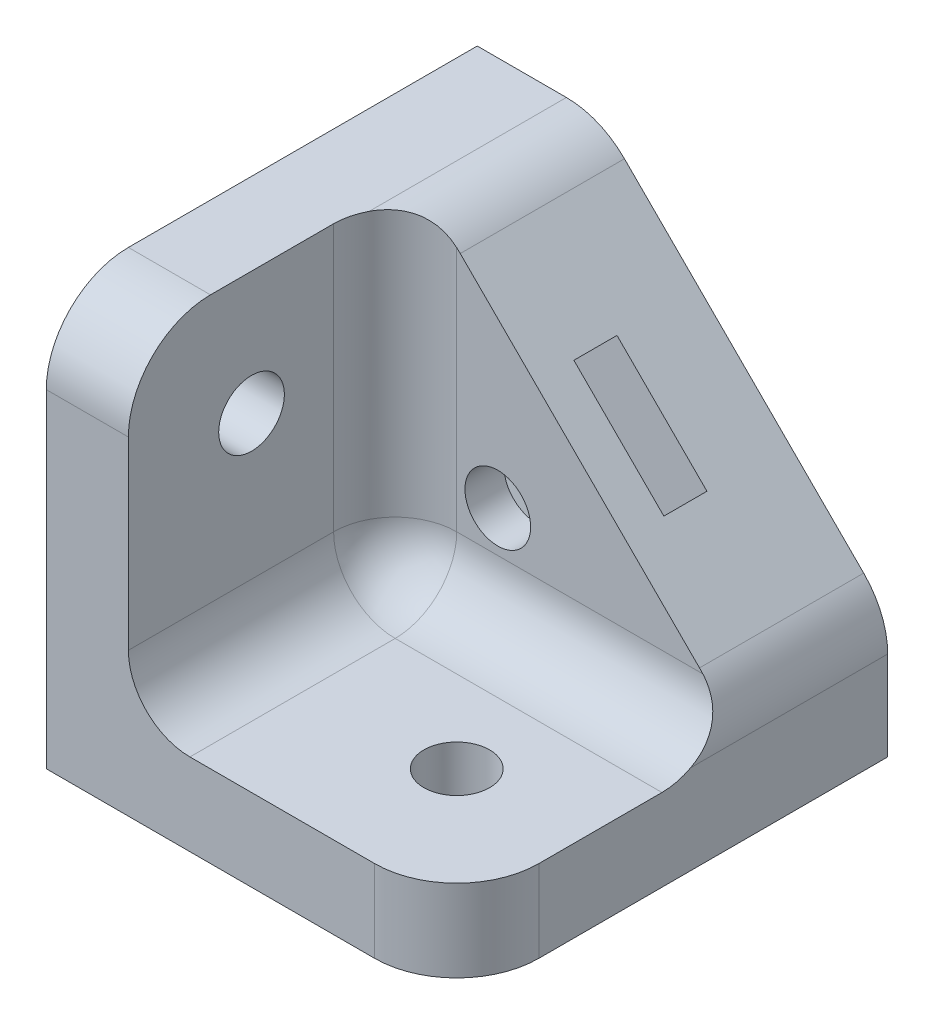
from build123d import *

# Parameters (mm, degrees)
BOSS_EXTRUDE4_DEPTH                  = 8
BOSS_EXTRUDE5_DEPTH                  = 21
SKETCH5_W                            = 2.1
SKETCH5_H                            = 6.2
CUT_EXTRUDE1_DEPTH                   = 9
F_3_2_3_2_DIAMETER_HOLE1_D           = 3.2
F_3_2_3_2_DIAMETER_HOLE1_ON_FACE_2_D = 3.2
F_3_2_3_2_DIAMETER_HOLE1_ON_FACE_3_D = 3.2
CHAMFER1_SIZE                        = 1.5
FILLET1_R                            = 3
FILLET2_R                            = 4


with BuildPart() as part:
    # Sketch4 → Boss-Extrude4 (new body)
    with BuildSketch(Plane.XY):
        Polygon((0, 20), (0, 0), (20, 0), (20, 6), (6, 20), align=None)
    extrude(amount=BOSS_EXTRUDE4_DEPTH)

    # Sketch4<4> → Boss-Extrude5 (add)
    with BuildSketch(Plane.XY):
        Polygon((0, 20), (0, 0), (20, 0), (20, 4), (4, 4), (4, 20), align=None)
    extrude(amount=BOSS_EXTRUDE5_DEPTH)

    # Sketch5 → Cut-Extrude1 (cut)
    with BuildSketch(Plane(origin=(13, 13, 0), x_dir=(0, 0, -1), z_dir=(0.7071067811865477, 0.7071067811865475, 0))):
        with Locations((-5.05, 0)):
            Rectangle(SKETCH5_W, SKETCH5_H)
    extrude(amount=-CUT_EXTRUDE1_DEPTH, mode=Mode.SUBTRACT)

    # Ø3.2 (3.2) Diameter Hole1 (through all)
    with Locations(Plane(origin=(14, 0, 15), x_dir=(0, 0, -1), z_dir=(0, -1, 0))):
        with Locations((0, 0)):
            Hole(F_3_2_3_2_DIAMETER_HOLE1_D / 2)

    # Ø3.2 (3.2) Diameter Hole1 on face 2 (through all)
    with Locations(Plane(origin=(0, 14, 15), x_dir=(0, 0, -1), z_dir=(-1, 0, 0))):
        with Locations((0, 0)):
            Hole(F_3_2_3_2_DIAMETER_HOLE1_ON_FACE_2_D / 2)

    # Ø3.2 (3.2) Diameter Hole1 on face 3 (through all)
    with Locations(Plane(origin=(9, 9, 0), x_dir=(-1, 0, 0), z_dir=(0, 0, -1))):
        with Locations((0, 0)):
            Hole(F_3_2_3_2_DIAMETER_HOLE1_ON_FACE_3_D / 2)

    # Chamfer1
    chamfer1_edges = [part.edges().sort_by_distance(p)[0] for p in [
        (4.444007948, 8.828069991, 5.05),
        (8.828069991, 4.444007948, 5.05),
    ]]
    chamfer(chamfer1_edges, length=CHAMFER1_SIZE)

    # Fillet1
    fillet1_edges = [part.edges().sort_by_distance(p)[0] for p in [
        (12, 4, 8),
        (4, 4, 14.5),
        (4, 12, 8),
    ]]
    fillet(fillet1_edges, radius=FILLET1_R)

    # Fillet2
    fillet2_edges = [part.edges().sort_by_distance(p)[0] for p in [
        (6, 20, 4.085786438),
        (20, 6, 4.085786438),
        (20, 2, 21),
        (2, 20, 21),
    ]]
    fillet(fillet2_edges, radius=FILLET2_R)


solid = part.part
